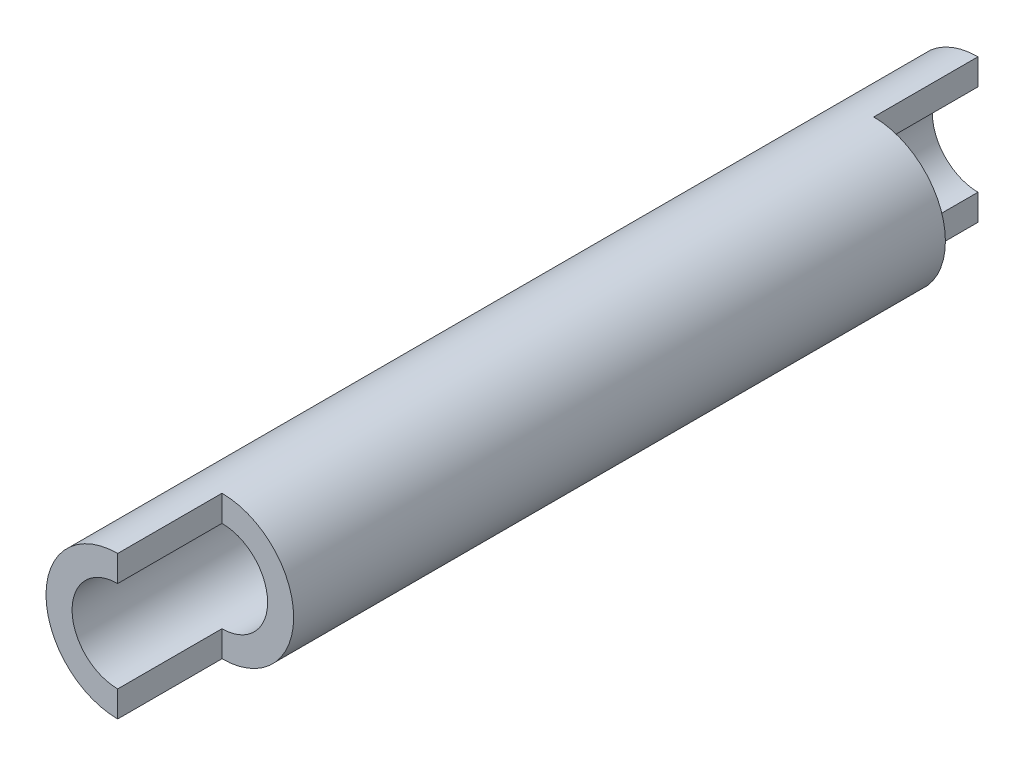
from build123d import *
from build123d.topology import SkipClean

# Parameters (mm, degrees)
SKETCH1_R                                        = 5.5
SKETCH1_R_2                                      = 3.5
BOSS_EXTRUDE1_DLUGOSC_CALKOWITA_DEPTH            = 50
BOSS_EXTRUDE2_PRZEDLUZENIE_DO_MONTAZU_DEPTH      = 8
BOSS_EXTRUDE2_PRZEDLUZENIE_DO_MONTAZU_DEPTH_BACK = 58


with BuildPart() as part:
    # Sketch1 → Boss-Extrude1 dlugosc calkowita (new body)
    with BuildSketch(Plane.XY):
        Circle(SKETCH1_R)
        Circle(SKETCH1_R_2, mode=Mode.SUBTRACT)
    extrude(amount=BOSS_EXTRUDE1_DLUGOSC_CALKOWITA_DEPTH)

    # Sketch2 → Boss-Extrude2 przedluzenie do montazu (add, two sides: drawn at the far end of the back side and taken through both)
    with SkipClean():  # the faces are left unmerged after this step: merging them gives an invalid solid
        with BuildSketch(Plane(origin=(0, 0, 0), x_dir=(-1, 0, 0), z_dir=(0, 0, -1)).offset(-BOSS_EXTRUDE2_PRZEDLUZENIE_DO_MONTAZU_DEPTH_BACK)):
            with BuildLine():
                Line((0, 5.5), (0, 3.5))
                ThreePointArc((0, 3.5), (3.5, 0), (0, -3.5))
                Line((0, -3.5), (0, -5.5))
                ThreePointArc((0, -5.5), (5.5, 0), (0, 5.5))
            make_face()
        extrude(amount=BOSS_EXTRUDE2_PRZEDLUZENIE_DO_MONTAZU_DEPTH + BOSS_EXTRUDE2_PRZEDLUZENIE_DO_MONTAZU_DEPTH_BACK)
    add(part.part.scale(1), mode=Mode.REPLACE)  # the faces are merged on a copy


solid = part.part
